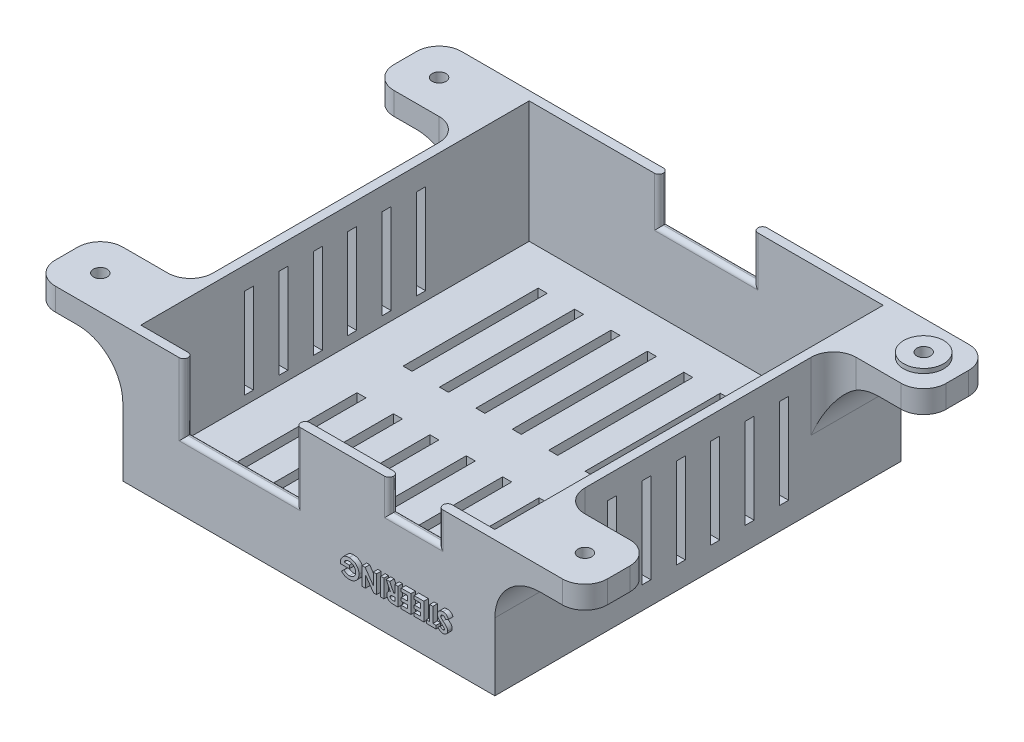
from build123d import *
from OCP.BRepFilletAPI import BRepFilletAPI_MakeFillet

# Parameters (mm, degrees)
SKETCH1_W               = 82.6
SKETCH1_H               = 90.22
BOSS_EXTRUDE1_DEPTH     = 30
SKETCH5_W               = 20
SKETCH5_H               = 15
BOSS_EXTRUDE3_DEPTH     = 5
SKETCH2_W               = 78.6
SKETCH2_H               = 86.22
CUT_EXTRUDE1_DEPTH      = 27
BOSS_EXTRUDE2_DEPTH     = 1
LEFTHOLESSKETCH_W       = 2
LEFTHOLESSKETCH_H       = 20
LEFTHOLES_DEPTH         = 126.035387059
BOTTOMHOLESSKETCH_W     = 11
BOTTOMHOLESSKETCH_H     = 7
BOTTOMHOLESSKETCH_W_2   = 25
BOTTOMHOLESSKETCH_H_2   = 15
BOTTOMHOLES_DEPTH       = 10
TOPHOLESSKETCH_W        = 21
TOPHOLESSKETCH_H        = 10
TOPHOLES_DEPTH          = 10
FILLET1_R1              = 10
FILLET1_R2              = 5
SKETCH6_6_R             = 4.45
BOSS_EXTRUDE4_DEPTH     = 1
CUT_EXTRUDE9_DEPTH      = 114.130807564
CUT_EXTRUDE9_DEPTH_BACK = 5
SKETCH6_R               = 1.525
FILLET2_R               = 1
SKETCH7_R               = 3.5
CUT_EXTRUDE10_DEPTH     = 10
SKETCH8_W               = 2
SKETCH8_H               = 30
CUT_EXTRUDE12_DEPTH     = 10
SKETCH9_W               = 0.717948718
SKETCH9_H               = 4
BOSS_EXTRUDE5_DEPTH     = 1


with BuildPart() as part:
    # Sketch1 → Boss-Extrude1 (new body)
    with BuildSketch(Plane(origin=(0, 0, 0), x_dir=(1, 0, 0), z_dir=(0, 1, 0))):
        with Locations((-26.401149425, -19.752068966)):
            Rectangle(SKETCH1_W, SKETCH1_H)
    extrude(amount=BOSS_EXTRUDE1_DEPTH)

    # Sketch5 → Boss-Extrude3 (add)
    with BuildSketch(Plane.XZ.offset(-30)):
        with Locations((24.898850575, -17.857931034)):
            Rectangle(SKETCH5_W, SKETCH5_H)
        with Locations((24.898850575, 57.362068966)):
            Rectangle(SKETCH5_W, SKETCH5_H)
        with Locations((-77.701149425, 57.362068966)):
            Rectangle(SKETCH5_W, SKETCH5_H)
        with Locations((-77.701149425, -17.857931034)):
            Rectangle(SKETCH5_W, SKETCH5_H)
    extrude(amount=BOSS_EXTRUDE3_DEPTH)

    # Sketch2 → Cut-Extrude1 (cut)
    with BuildSketch(Plane(origin=(0, 30, 0), x_dir=(1, 0, 0), z_dir=(0, 1, 0))):
        with Locations((-26.401149425, -19.752068966)):
            Rectangle(SKETCH2_W, SKETCH2_H)
    extrude(amount=-CUT_EXTRUDE1_DEPTH, mode=Mode.SUBTRACT)

    # Sketch4 → Boss-Extrude2 (add)
    # profile 1 of 6: a face of its own
    with BuildSketch(Plane(origin=(-31.128581926, 28.357931034, -25.357931034), x_dir=(-1, 0, 0), z_dir=(0, 0, 1))):
        with BuildLine():
            Line((-6.66624498, 19.200827591), (-8.765713729, 18.098011185))
            Line((-8.765713729, 18.098011185), (-6.66624498, 16.996683061))
            add(Edge.make_bspline(
                [(-6.66624498, 16.996683061), (-3.948147324, 18.053858842), (-3.718703965, 18.053858842), (-0.999614122, 16.996683061)],
                knots=[1, 1, 1, 1, 2, 2, 2, 2], degree=3))
            Line((-0.999614122, 16.996683061), (1.099358534, 18.098011185))
            Line((1.099358534, 18.098011185), (-0.999614122, 19.200827591))
            add(Edge.make_bspline(
                [(-0.999614122, 19.200827591), (-3.718703965, 18.143155717), (-3.948147324, 18.143155717), (-6.66624498, 19.200827591)],
                knots=[4, 4, 4, 4, 5, 5, 5, 5], degree=3))
        make_face()
    # profile 2 of 6: a face of its own
    with BuildSketch(Plane(origin=(-31.128581926, 28.357931034, -25.357931034), x_dir=(-1, 0, 0), z_dir=(0, 0, 1))):
        with BuildLine():
            Line((-6.66624498, 16.476280717), (-8.765713729, 15.374456499))
            Line((-8.765713729, 15.374456499), (-6.66624498, 14.272136186))
            add(Edge.make_bspline(
                [(-6.66624498, 14.272136186), (-3.948147324, 15.329808061), (-3.718703965, 15.329808061), (-0.999614122, 14.272136186)],
                knots=[1, 1, 1, 1, 2, 2, 2, 2], degree=3))
            Line((-0.999614122, 14.272136186), (1.099358534, 15.374456499))
            Line((1.099358534, 15.374456499), (-0.999614122, 16.476280717))
            add(Edge.make_bspline(
                [(-0.999614122, 16.476280717), (-3.718703965, 15.419104936), (-3.948147324, 15.419104936), (-6.66624498, 16.476280717)],
                knots=[4, 4, 4, 4, 5, 5, 5, 5], degree=3))
        make_face()
    # profile 3 of 6: a face of its own
    with BuildSketch(Plane(origin=(-31.128581926, 28.357931034, -25.357931034), x_dir=(-1, 0, 0), z_dir=(0, 0, 1))):
        with BuildLine():
            Line((-6.66624498, 13.752229936), (-8.765713729, 12.650405718))
            Line((-8.765713729, 12.650405718), (-6.66624498, 11.548581499))
            add(Edge.make_bspline(
                [(-6.66624498, 11.548581499), (-3.948147324, 12.60575728), (-3.718703965, 12.60575728), (-0.999614122, 11.548581499)],
                knots=[1, 1, 1, 1, 2, 2, 2, 2], degree=3))
            Line((-0.999614122, 11.548581499), (1.099358534, 12.650405718))
            Line((1.099358534, 12.650405718), (-0.999614122, 13.752229936))
            add(Edge.make_bspline(
                [(-0.999614122, 13.752229936), (-3.718703965, 12.694558062), (-3.948147324, 12.694558062), (-6.66624498, 13.752229936)],
                knots=[4, 4, 4, 4, 5, 5, 5, 5], degree=3))
        make_face()
    # profile 4 of 6: a face of its own
    with BuildSketch(Plane(origin=(-31.128581926, 28.357931034, -25.357931034), x_dir=(-1, 0, 0), z_dir=(0, 0, 1))):
        with BuildLine():
            Line((-0.845328966, 25.939268996), (0.464358534, 25.939268996))
            add(Edge.make_bspline(
                [(0.464358534, 25.939268996), (0.50354994, 25.939268996), (0.527610487, 25.927362746), (0.545221815, 25.910495558)],
                knots=[0, 0, 0, 0, 1, 1, 1, 1], degree=3))
            add(Edge.make_bspline(
                [(0.545221815, 25.910495558), (0.562585097, 25.892636183), (0.573995253, 25.869319777), (0.573995253, 25.829632277)],
                knots=[1, 1, 1, 1, 2, 2, 2, 2], degree=3))
            Line((0.573995253, 25.829632277), (0.573995253, 20.823054153))
            add(Edge.make_bspline(
                [(0.573995253, 20.823054153), (0.573995253, 20.783862747), (0.562585097, 20.760050247), (0.545221815, 20.742686966)],
                knots=[3, 3, 3, 3, 4, 4, 4, 4], degree=3))
            add(Edge.make_bspline(
                [(0.545221815, 20.742686966), (0.527610487, 20.725323685), (0.50354994, 20.713417435), (0.464358534, 20.713417435)],
                knots=[4, 4, 4, 4, 5, 5, 5, 5], degree=3))
            Line((0.464358534, 20.713417435), (-0.845328966, 20.713417435))
            add(Edge.make_bspline(
                [(-0.845328966, 20.713417435), (-1.354073106, 20.713417435), (-1.664379747, 20.829007278), (-1.852399278, 21.07258931)],
                knots=[6, 6, 6, 6, 7, 7, 7, 7], degree=3))
            add(Edge.make_bspline(
                [(-1.852399278, 21.07258931), (-2.129963731, 21.404972122), (-2.138893418, 21.941745559), (-2.138893418, 22.76476509)],
                knots=[7, 7, 7, 7, 8, 8, 8, 8], degree=3))
            Line((-2.138893418, 22.76476509), (-2.138893418, 23.88792134))
            add(Edge.make_bspline(
                [(-2.138893418, 23.88792134), (-2.138893418, 24.710940871), (-2.129963731, 25.247714309), (-1.852399278, 25.580097121)],
                knots=[9, 9, 9, 9, 10, 10, 10, 10], degree=3))
            add(Edge.make_bspline(
                [(-1.852399278, 25.580097121), (-1.664379747, 25.823679152), (-1.354073106, 25.939268996), (-0.845328966, 25.939268996)],
                knots=[10, 10, 10, 10, 11, 11, 11, 11], degree=3))
        make_face()
        with BuildLine():
            Line((-0.256961778, 21.324604935), (-0.256961778, 25.32857759))
            Line((-0.256961778, 25.32857759), (-0.718825059, 25.32857759))
            add(Edge.make_bspline(
                [(-0.718825059, 25.32857759), (-0.922719591, 25.32857759), (-1.044510606, 25.295339309), (-1.138768419, 25.182229934)],
                knots=[1, 1, 1, 1, 2, 2, 2, 2], degree=3))
            add(Edge.make_bspline(
                [(-1.138768419, 25.182229934), (-1.284123887, 25.007604934), (-1.296526231, 24.655378371), (-1.296526231, 23.945468215)],
                knots=[2, 2, 2, 2, 3, 3, 3, 3], degree=3))
            Line((-1.296526231, 23.945468215), (-1.296526231, 22.707218215))
            add(Edge.make_bspline(
                [(-1.296526231, 22.707218215), (-1.296526231, 21.997308059), (-1.284123887, 21.645081497), (-1.138768419, 21.470456497)],
                knots=[4, 4, 4, 4, 5, 5, 5, 5], degree=3))
            add(Edge.make_bspline(
                [(-1.138768419, 21.470456497), (-1.044510606, 21.357347122), (-0.922719591, 21.324604935), (-0.718825059, 21.324604935)],
                knots=[5, 5, 5, 5, 6, 6, 6, 6], degree=3))
            Line((-0.718825059, 21.324604935), (-0.256961778, 21.324604935))
        make_face(mode=Mode.SUBTRACT)
    # profile 5 of 6: a face of its own
    with BuildSketch(Plane(origin=(-31.128581926, 28.357931034, -25.357931034), x_dir=(-1, 0, 0), z_dir=(0, 0, 1))):
        with BuildLine():
            Line((-8.211577011, 22.132245559), (-8.211577011, 25.829632277))
            add(Edge.make_bspline(
                [(-8.211577011, 25.829632277), (-8.211577011, 25.869319777), (-8.199670761, 25.892636183), (-8.182307479, 25.910495558)],
                knots=[0, 0, 0, 0, 1, 1, 1, 1], degree=3))
            add(Edge.make_bspline(
                [(-8.182307479, 25.910495558), (-8.165192245, 25.927362746), (-8.140883651, 25.939268996), (-8.101940292, 25.939268996)],
                knots=[1, 1, 1, 1, 2, 2, 2, 2], degree=3))
            Line((-8.101940292, 25.939268996), (-7.489760605, 25.939268996))
            add(Edge.make_bspline(
                [(-7.489760605, 25.939268996), (-7.450569198, 25.939268996), (-7.426756698, 25.927362746), (-7.409393417, 25.910495558)],
                knots=[3, 3, 3, 3, 4, 4, 4, 4], degree=3))
            add(Edge.make_bspline(
                [(-7.409393417, 25.910495558), (-7.391782089, 25.892636183), (-7.380123886, 25.869319777), (-7.380123886, 25.829632277)],
                knots=[4, 4, 4, 4, 5, 5, 5, 5], degree=3))
            Line((-7.380123886, 25.829632277), (-7.380123886, 22.133237747))
            add(Edge.make_bspline(
                [(-7.380123886, 22.133237747), (-7.380123886, 21.747772903), (-7.350854355, 21.518577591), (-7.22583873, 21.380663528)],
                knots=[6, 6, 6, 6, 7, 7, 7, 7], degree=3))
            add(Edge.make_bspline(
                [(-7.22583873, 21.380663528), (-7.140758652, 21.287397903), (-7.02020787, 21.241757278), (-6.852032089, 21.241757278)],
                knots=[7, 7, 7, 7, 8, 8, 8, 8], degree=3))
            add(Edge.make_bspline(
                [(-6.852032089, 21.241757278), (-6.69873912, 21.241757278), (-6.583149277, 21.284421341), (-6.494844589, 21.381655716)],
                knots=[8, 8, 8, 8, 9, 9, 9, 9], degree=3))
            add(Edge.make_bspline(
                [(-6.494844589, 21.381655716), (-6.376278183, 21.512128372), (-6.340311386, 21.733882278), (-6.340311386, 22.133237747)],
                knots=[9, 9, 9, 9, 10, 10, 10, 10], degree=3))
            Line((-6.340311386, 22.133237747), (-6.340311386, 25.829632277))
            add(Edge.make_bspline(
                [(-6.340311386, 25.829632277), (-6.340311386, 25.869319777), (-6.328157089, 25.892636183), (-6.310545761, 25.910495558)],
                knots=[11, 11, 11, 11, 12, 12, 12, 12], degree=3))
            add(Edge.make_bspline(
                [(-6.310545761, 25.910495558), (-6.293678574, 25.927362746), (-6.269618027, 25.939268996), (-6.230178574, 25.939268996)],
                knots=[12, 12, 12, 12, 13, 13, 13, 13], degree=3))
            Line((-6.230178574, 25.939268996), (-5.61849498, 25.939268996))
            add(Edge.make_bspline(
                [(-5.61849498, 25.939268996), (-5.579055527, 25.939268996), (-5.55499498, 25.927362746), (-5.538127793, 25.910495558)],
                knots=[14, 14, 14, 14, 15, 15, 15, 15], degree=3))
            add(Edge.make_bspline(
                [(-5.538127793, 25.910495558), (-5.520268418, 25.892636183), (-5.508858261, 25.869319777), (-5.508858261, 25.829632277)],
                knots=[15, 15, 15, 15, 16, 16, 16, 16], degree=3))
            Line((-5.508858261, 25.829632277), (-5.508858261, 22.132245559))
            add(Edge.make_bspline(
                [(-5.508858261, 22.132245559), (-5.508858261, 21.593983841), (-5.582032089, 21.256640091), (-5.795848496, 21.021491653)],
                knots=[17, 17, 17, 17, 18, 18, 18, 18], degree=3))
            add(Edge.make_bspline(
                [(-5.795848496, 21.021491653), (-6.017850449, 20.776917435), (-6.353953964, 20.647436966), (-6.862698105, 20.647436966)],
                knots=[18, 18, 18, 18, 19, 19, 19, 19], degree=3))
            add(Edge.make_bspline(
                [(-6.862698105, 20.647436966), (-7.37739537, 20.647436966), (-7.708785995, 20.785351028), (-7.912680526, 21.021987747)],
                knots=[19, 19, 19, 19, 20, 20, 20, 20], degree=3))
            add(Edge.make_bspline(
                [(-7.912680526, 21.021987747), (-8.152293808, 21.300296341), (-8.211577011, 21.632679153), (-8.211577011, 22.132245559)],
                knots=[20, 20, 20, 20, 21, 21, 21, 21], degree=3))
        make_face()
    # profile 6 of 6: a face of its own
    with BuildSketch(Plane(origin=(-31.128581926, 28.357931034, -25.357931034), x_dir=(-1, 0, 0), z_dir=(0, 0, 1))):
        with BuildLine():
            Line((-4.259694199, 25.278968215), (-4.259694199, 20.823054153))
            add(Edge.make_bspline(
                [(-4.259694199, 20.823054153), (-4.259694199, 20.783862747), (-4.248284043, 20.760050247), (-4.230920762, 20.742686966)],
                knots=[0, 0, 0, 0, 1, 1, 1, 1], degree=3))
            add(Edge.make_bspline(
                [(-4.230920762, 20.742686966), (-4.213309434, 20.725323685), (-4.189496934, 20.713417435), (-4.150553574, 20.713417435)],
                knots=[1, 1, 1, 1, 2, 2, 2, 2], degree=3))
            Line((-4.150553574, 20.713417435), (-3.480578965, 20.713417435))
            add(Edge.make_bspline(
                [(-3.480578965, 20.713417435), (-3.441635606, 20.713417435), (-3.417327012, 20.725323685), (-3.400211777, 20.742686966)],
                knots=[3, 3, 3, 3, 4, 4, 4, 4], degree=3))
            add(Edge.make_bspline(
                [(-3.400211777, 20.742686966), (-3.382352402, 20.760050247), (-3.370942246, 20.783862747), (-3.370942246, 20.823054153)],
                knots=[4, 4, 4, 4, 5, 5, 5, 5], degree=3))
            Line((-3.370942246, 20.823054153), (-3.370942246, 25.278968215))
            Line((-3.370942246, 25.278968215), (-2.5848817, 25.278968215))
            add(Edge.make_bspline(
                [(-2.5848817, 25.278968215), (-2.545442246, 25.278968215), (-2.521877793, 25.290378371), (-2.504018418, 25.307741652)],
                knots=[7, 7, 7, 7, 8, 8, 8, 8], degree=3))
            add(Edge.make_bspline(
                [(-2.504018418, 25.307741652), (-2.486655137, 25.325104934), (-2.474748887, 25.349413527), (-2.474748887, 25.388604934)],
                knots=[8, 8, 8, 8, 9, 9, 9, 9], degree=3))
            Line((-2.474748887, 25.388604934), (-2.474748887, 25.829632277))
            add(Edge.make_bspline(
                [(-2.474748887, 25.829632277), (-2.474748887, 25.869319777), (-2.486655137, 25.892636183), (-2.504018418, 25.910495558)],
                knots=[10, 10, 10, 10, 11, 11, 11, 11], degree=3))
            add(Edge.make_bspline(
                [(-2.504018418, 25.910495558), (-2.521877793, 25.927362746), (-2.545442246, 25.939268996), (-2.5848817, 25.939268996)],
                knots=[11, 11, 11, 11, 12, 12, 12, 12], degree=3))
            Line((-2.5848817, 25.939268996), (-5.046002793, 25.939268996))
            add(Edge.make_bspline(
                [(-5.046002793, 25.939268996), (-5.085442246, 25.939268996), (-5.109502793, 25.927362746), (-5.127114121, 25.910495558)],
                knots=[13, 13, 13, 13, 14, 14, 14, 14], degree=3))
            add(Edge.make_bspline(
                [(-5.127114121, 25.910495558), (-5.143733261, 25.892636183), (-5.155887558, 25.869319777), (-5.155887558, 25.829632277)],
                knots=[14, 14, 14, 14, 15, 15, 15, 15], degree=3))
            Line((-5.155887558, 25.829632277), (-5.155887558, 25.388604934))
            add(Edge.make_bspline(
                [(-5.155887558, 25.388604934), (-5.155887558, 25.349413527), (-5.143733261, 25.325104934), (-5.127114121, 25.307741652)],
                knots=[16, 16, 16, 16, 17, 17, 17, 17], degree=3))
            add(Edge.make_bspline(
                [(-5.127114121, 25.307741652), (-5.109502793, 25.290378371), (-5.085442246, 25.278968215), (-5.046002793, 25.278968215)],
                knots=[17, 17, 17, 17, 18, 18, 18, 18], degree=3))
            Line((-5.046002793, 25.278968215), (-4.259694199, 25.278968215))
        make_face()
    extrude(amount=-BOSS_EXTRUDE2_DEPTH)

    # LeftHolesSketch → LeftHoles (cut, through all)
    with BuildSketch(Plane(origin=(14.898850575, 0, 0), x_dir=(0, 0, -1), z_dir=(1, 0, 0))):
        with Locations((-38.862068966, 15)):
            Rectangle(LEFTHOLESSKETCH_W, LEFTHOLESSKETCH_H)
        with Locations((-31.218068966, 15)):
            Rectangle(LEFTHOLESSKETCH_W, LEFTHOLESSKETCH_H)
        with Locations((-23.574068966, 15)):
            Rectangle(LEFTHOLESSKETCH_W, LEFTHOLESSKETCH_H)
        with Locations((-15.930068966, 15)):
            Rectangle(LEFTHOLESSKETCH_W, LEFTHOLESSKETCH_H)
        with Locations((-8.286068966, 15)):
            Rectangle(LEFTHOLESSKETCH_W, LEFTHOLESSKETCH_H)
        with Locations((-0.642068966, 15)):
            Rectangle(LEFTHOLESSKETCH_W, LEFTHOLESSKETCH_H)
    extrude(amount=-LEFTHOLES_DEPTH, mode=Mode.SUBTRACT)

    # BottomHolesSketch → BottomHoles (cut)
    with BuildSketch(Plane.XY.offset(64.862068966)):
        with Locations((-3.101149425, 26.5)):
            Rectangle(BOTTOMHOLESSKETCH_W, BOTTOMHOLESSKETCH_H)
        with Locations((-41.701149425, 22.5)):
            Rectangle(BOTTOMHOLESSKETCH_W_2, BOTTOMHOLESSKETCH_H_2)
    extrude(amount=-BOTTOMHOLES_DEPTH, mode=Mode.SUBTRACT)

    # TopHolesSketch → TopHoles (cut)
    with BuildSketch(Plane(origin=(0, 0, -25.357931034), x_dir=(-1, 0, 0), z_dir=(0, 0, -1))):
        with Locations((26.401149425, 25)):
            Rectangle(TOPHOLESSKETCH_W, TOPHOLESSKETCH_H)
    extrude(amount=-TOPHOLES_DEPTH, mode=Mode.SUBTRACT)

    # Fillet1: one fillet with a radius per group of edges: ONE call of the kernel's fillet builder (fillet() takes one radius for all edges)
    fillet1_edges_1 = [part.edges().sort_by_distance(p)[0] for p in [
        (-67.701149425, 25, -17.857931034),
        (-67.701149425, 25, 57.362068966),
        (14.898850575, 25, -17.857931034),
        (14.898850575, 25, 57.362068966),
    ]]
    fillet1_edges_2 = [part.edges().sort_by_distance(p)[0] for p in [
        (-87.701149425, 27.5, -25.357931034),
        (-87.701149425, 27.5, -10.357931034),
        (-67.701149425, 27.5, -10.357931034),
        (-67.701149425, 27.5, 49.862068966),
        (-87.701149425, 27.5, 49.862068966),
        (-87.701149425, 27.5, 64.862068966),
        (14.898850575, 27.5, 49.862068966),
        (34.898850575, 27.5, 49.862068966),
        (34.898850575, 27.5, 64.862068966),
        (34.898850575, 27.5, -25.357931034),
        (34.898850575, 27.5, -10.357931034),
        (14.898850575, 27.5, -10.357931034),
    ]]
    fillet1 = BRepFilletAPI_MakeFillet(part.part.solid().wrapped)
    for e in fillet1_edges_1:
        fillet1.Add(FILLET1_R1, e.wrapped)
    for e in fillet1_edges_2:
        fillet1.Add(FILLET1_R2, e.wrapped)
    add(Compound.cast(fillet1.Shape()), mode=Mode.REPLACE)

    # Sketch6<6> → Boss-Extrude4 (add)
    with BuildSketch(Plane(origin=(0, 30, 0), x_dir=(-1, 0, 0), z_dir=(0, -1, 0))):
        with Locations(Location((-27.398850575, 17.857931034, 0), (0, 0, 90))):
            Circle(SKETCH6_6_R)
    extrude(amount=-BOSS_EXTRUDE4_DEPTH)

    # Sketch6 → Cut-Extrude9 (cut, two sides: drawn at the far end of the back side and taken through both)
    with BuildSketch(Plane(origin=(0, 30, 0), x_dir=(-1, 0, 0), z_dir=(0, -1, 0)).offset(-CUT_EXTRUDE9_DEPTH_BACK)):
        with Locations(Location((-27.398850575, 17.857931034, 0), (0, 0, 90))):
            Circle(SKETCH6_R)
        with Locations(Location((-27.398850575, -57.362068966, 0), (0, 0, 270))):
            Circle(SKETCH6_R)
        with Locations(Location((80.201149425, -57.362068966, 0), (0, 0, 90))):
            Circle(SKETCH6_R)
        with Locations(Location((80.201149425, 17.857931034, 0), (0, 0, 270))):
            Circle(SKETCH6_R)
    extrude(amount=CUT_EXTRUDE9_DEPTH + CUT_EXTRUDE9_DEPTH_BACK, mode=Mode.SUBTRACT)

    # Fillet2
    fillet2_edges = [part.edges().sort_by_distance(p)[0] for p in [
        (-3.101149425, 23, 62.862068966),
        (-3.101149425, 23, 64.862068966),
        (-8.601149425, 26.5, 62.862068966),
        (-8.601149425, 26.5, 64.862068966),
        (2.398850575, 26.5, 62.862068966),
        (2.398850575, 26.5, 64.862068966),
        (-41.701149425, 15, 62.862068966),
        (-41.701149425, 15, 64.862068966),
        (-54.201149425, 22.5, 64.862068966),
        (-54.201149425, 22.5, 62.862068966),
        (-29.201149425, 22.5, 62.862068966),
        (-29.201149425, 22.5, 64.862068966),
        (-36.901149425, 25, -23.357931034),
        (-36.901149425, 25, -25.357931034),
        (-15.901149425, 25, -25.357931034),
        (-15.901149425, 25, -23.357931034),
        (-26.401149425, 20, -23.357931034),
        (-26.401149425, 20, -25.357931034),
    ]]
    fillet(fillet2_edges, radius=FILLET2_R - 0.0001)  # a hair under: the kernel refuses the full size

    # Sketch7 → Cut-Extrude10 (cut)
    with BuildSketch(Plane.XZ.offset(-25)):
        with Locations((-80.201149425, 57.362068966)):
            Circle(SKETCH7_R)
        with Locations((27.398850575, 57.362068966)):
            Circle(SKETCH7_R)
        with Locations((27.398850575, -17.857931034)):
            Circle(SKETCH7_R)
        with Locations((-80.201149425, -17.857931034)):
            Circle(SKETCH7_R)
    extrude(amount=CUT_EXTRUDE10_DEPTH, mode=Mode.SUBTRACT)

    # Sketch8 → Cut-Extrude12 (cut)
    with BuildSketch(Plane.XZ):
        with Locations((-6.186863711, -0.357931034)):
            Rectangle(SKETCH8_W, SKETCH8_H)
        with Locations((1.898850575, -0.357931034)):
            Rectangle(SKETCH8_W, SKETCH8_H)
        with Locations((-14.272577997, -0.357931034)):
            Rectangle(SKETCH8_W, SKETCH8_H)
        with Locations((-22.358292282, -0.357931034)):
            Rectangle(SKETCH8_W, SKETCH8_H)
        with Locations((-30.444006568, -0.357931034)):
            Rectangle(SKETCH8_W, SKETCH8_H)
        with Locations((-38.529720854, -0.357931034)):
            Rectangle(SKETCH8_W, SKETCH8_H)
        with Locations((-46.61543514, -0.357931034)):
            Rectangle(SKETCH8_W, SKETCH8_H)
        with Locations((-54.701149425, -0.357931034)):
            Rectangle(SKETCH8_W, SKETCH8_H)
        with Locations((-6.186863711, 39.862068966)):
            Rectangle(SKETCH8_W, SKETCH8_H)
        with Locations((-14.272577997, 39.862068966)):
            Rectangle(SKETCH8_W, SKETCH8_H)
        with Locations((-22.358292282, 39.862068966)):
            Rectangle(SKETCH8_W, SKETCH8_H)
        with Locations((-30.444006568, 39.862068966)):
            Rectangle(SKETCH8_W, SKETCH8_H)
        with Locations((-38.529720854, 39.862068966)):
            Rectangle(SKETCH8_W, SKETCH8_H)
        with Locations((-46.61543514, 39.862068966)):
            Rectangle(SKETCH8_W, SKETCH8_H)
        with Locations((-54.701149425, 39.862068966)):
            Rectangle(SKETCH8_W, SKETCH8_H)
        with Locations((1.898850575, 39.862068966)):
            Rectangle(SKETCH8_W, SKETCH8_H)
    extrude(amount=-CUT_EXTRUDE12_DEPTH, mode=Mode.SUBTRACT)

    # Sketch9 → Boss-Extrude5 (add)
    # profile 1 of 8: a face of its own
    with BuildSketch(Plane.XY.offset(64.862068966)):
        with BuildLine():
            Line((3.268192278, 7.862766785), (3.805051252, 8.353952683))
            add(Edge.make_bspline(
                [(3.805051252, 8.353952683), (3.828043563, 8.3215076), (3.872185595, 8.259217566), (3.943807144, 8.175900794), (4.015000806, 8.104359121), (4.087222207, 8.046638006), (4.159227921, 8.000170689), (4.232547748, 7.968120307), (4.306338195, 7.947508515), (4.35594002, 7.944954347), (4.380371765, 7.943696272)],
                knots=[0, 0, 0, 0, 1.299459705, 2.494781419, 3.587730629, 4.594196874, 5.512431013, 6.380462003, 7.202284646, 8, 8, 8, 8], degree=3))
            add(Edge.make_bspline(
                [(4.380371765, 7.943696272), (4.403170329, 7.944471661), (4.447188368, 7.945968733), (4.509647058, 7.961598337), (4.565776743, 7.986854935), (4.61408228, 8.021742897), (4.652943033, 8.063409247), (4.68315959, 8.10776511), (4.70071849, 8.156127606), (4.702973399, 8.189295452), (4.704089713, 8.205715503)],
                knots=[0, 0, 0, 0, 1.184157716, 2.286297433, 3.324836695, 4.370048774, 5.362957217, 6.276446515, 7.146738784, 8, 8, 8, 8], degree=3))
            add(Edge.make_bspline(
                [(4.704089713, 8.205715503), (4.703383088, 8.222364632), (4.701960043, 8.255893663), (4.688215364, 8.305034634), (4.667498209, 8.353051084), (4.647702121, 8.382280981), (4.637583303, 8.397221913)],
                knots=[0, 0, 0, 0, 0.967525499, 1.948461899, 2.951351359, 4, 4, 4, 4], degree=3))
            add(Edge.make_bspline(
                [(4.637583303, 8.397221913), (4.628347107, 8.408800794), (4.606963756, 8.435607853), (4.567429234, 8.478744125), (4.515735467, 8.529383708), (4.454067342, 8.590078189), (4.380110571, 8.658469978), (4.295453038, 8.736539281), (4.198211212, 8.821634142), (4.130083388, 8.881707235), (4.094314072, 8.913247555)],
                knots=[0, 0, 0, 0, 0.473849886, 1.097042329, 1.870584189, 2.789244661, 3.865562256, 5.093556389, 6.47402294, 8, 8, 8, 8], degree=3))
            add(Edge.make_bspline(
                [(4.094314072, 8.913247555), (4.060658973, 8.942359456), (3.996788588, 8.997607798), (3.906028886, 9.076152902), (3.825746899, 9.14650086), (3.756672758, 9.20917846), (3.696742364, 9.261604558), (3.648606302, 9.307004479), (3.610204447, 9.343392175), (3.588396694, 9.36539555), (3.579089713, 9.374786016)],
                knots=[0, 0, 0, 0, 1.543627419, 2.929484142, 4.163674036, 5.24627963, 6.164986907, 6.925413438, 7.541394495, 8, 8, 8, 8], degree=3))
            add(Edge.make_bspline(
                [(3.579089713, 9.374786016), (3.543759199, 9.412991186), (3.475841543, 9.48643494), (3.387745561, 9.600557768), (3.314458221, 9.711103653), (3.25770468, 9.821194227), (3.216544501, 9.933104619), (3.18658135, 10.048431511), (3.168621334, 10.168823849), (3.166633569, 10.250794106), (3.165628175, 10.292253965)],
                knots=[0, 0, 0, 0, 1.206413378, 2.319150186, 3.339784753, 4.27899982, 5.184598145, 6.099639703, 7.038813909, 8, 8, 8, 8], degree=3))
            add(Edge.make_bspline(
                [(3.165628175, 10.292253965), (3.166344669, 10.332651845), (3.167750457, 10.411913989), (3.184950019, 10.527907713), (3.209510643, 10.638898151), (3.247355668, 10.743773404), (3.293870185, 10.843776329), (3.350560163, 10.938940555), (3.419869327, 11.027044377), (3.496851607, 11.110465079), (3.583333077, 11.185343855), (3.676328505, 11.251359157), (3.776014989, 11.30709753), (3.881632847, 11.353031695), (3.994506696, 11.387119915), (4.112853402, 11.412892596), (4.237865354, 11.428432304), (4.323169435, 11.430049539), (4.36674997, 11.43087576)],
                knots=[0, 0, 0, 0, 1.043039441, 2.046482205, 3.024244422, 3.976033659, 4.920890471, 5.871402525, 6.830893638, 7.812473116, 8.800703348, 9.781190227, 10.754606487, 11.746997808, 12.751247331, 13.796362838, 14.874195872, 16, 16, 16, 16], degree=3))
            add(Edge.make_bspline(
                [(4.36674997, 11.43087576), (4.400960821, 11.430269498), (4.468717927, 11.429068753), (4.56857694, 11.419245528), (4.665020177, 11.403441856), (4.75785501, 11.380615982), (4.847668676, 11.352353694), (4.933486499, 11.315602622), (5.016449479, 11.274042017), (5.096281717, 11.225880007), (5.172321684, 11.169944506), (5.246760233, 11.108443256), (5.316958443, 11.038003174), (5.385598396, 10.96119218), (5.44981335, 10.875784107), (5.512987085, 10.784348964), (5.572036275, 10.684700936), (5.608527651, 10.61481111), (5.627166637, 10.579112939)],
                knots=[0, 0, 0, 0, 1.017088714, 2.014418954, 2.980620591, 3.920647918, 4.854987948, 5.776890852, 6.693269322, 7.612671471, 8.545186947, 9.498010697, 10.480815007, 11.499174288, 12.558697099, 13.655746277, 14.802607237, 16, 16, 16, 16], degree=3))
            Line((5.627166637, 10.579112939), (4.99575638, 10.200106529))
            add(Edge.make_bspline(
                [(4.99575638, 10.200106529), (4.972443454, 10.240629973), (4.927750581, 10.318316879), (4.852014331, 10.422699084), (4.774426408, 10.512085164), (4.693193051, 10.584895214), (4.609302026, 10.642102799), (4.522348121, 10.682987308), (4.432270242, 10.708294773), (4.370913283, 10.711385399), (4.340307662, 10.712927042)],
                knots=[0, 0, 0, 0, 1.283663364, 2.460892379, 3.537111102, 4.529833553, 5.449777664, 6.316464042, 7.160231139, 8, 8, 8, 8], degree=3))
            add(Edge.make_bspline(
                [(4.340307662, 10.712927042), (4.309171631, 10.711680016), (4.248763196, 10.709260604), (4.162395937, 10.686472199), (4.082864127, 10.651495002), (4.014486967, 10.600626048), (3.956421614, 10.542620644), (3.914794723, 10.477199682), (3.887792814, 10.407265484), (3.884987703, 10.358464653), (3.883576893, 10.333920631)],
                knots=[0, 0, 0, 0, 1.13537643, 2.202795631, 3.242191317, 4.290390765, 5.297919085, 6.223733717, 7.106639842, 8, 8, 8, 8], degree=3))
            add(Edge.make_bspline(
                [(3.883576893, 10.333920631), (3.884897451, 10.311097874), (3.88758004, 10.264735626), (3.907231621, 10.195762401), (3.938210833, 10.127123624), (3.973763117, 10.070228389), (4.010828288, 10.022803844), (4.047159257, 9.982330486), (4.090217738, 9.93667894), (4.141100886, 9.887094073), (4.198819031, 9.832622526), (4.263561132, 9.773393809), (4.3360244, 9.709890725), (4.387243639, 9.666634819), (4.414025611, 9.644016785)],
                knots=[0, 0, 0, 0, 0.916057066, 1.860882232, 2.859899639, 3.934694552, 4.546382938, 5.276161949, 6.118633209, 7.067046139, 8.129668089, 9.306861125, 10.591787583, 12, 12, 12, 12], degree=3))
            add(Edge.make_bspline(
                [(4.414025611, 9.644016785), (4.464937298, 9.600937788), (4.562652236, 9.518256154), (4.700760496, 9.396162161), (4.825121765, 9.28196916), (4.934906647, 9.174763595), (5.030441257, 9.075230442), (5.112777297, 8.984243507), (5.18058426, 8.900018549), (5.25089592, 8.799421808), (5.319592474, 8.678566724), (5.377974767, 8.532481017), (5.415706275, 8.386578218), (5.4199498, 8.28846248), (5.422038431, 8.240170631)],
                knots=[0, 0, 0, 0, 1.345685333, 2.582777463, 3.719355561, 4.752181389, 5.678433858, 6.502864483, 7.227563063, 7.858499643, 8.978226409, 10.023061349, 11.026965269, 12, 12, 12, 12], degree=3))
            add(Edge.make_bspline(
                [(5.422038431, 8.240170631), (5.421169365, 8.205925451), (5.41945721, 8.138458767), (5.404229748, 8.039247206), (5.381365887, 7.943561631), (5.348509105, 7.851426254), (5.304439162, 7.763879025), (5.252384485, 7.679502973), (5.190862836, 7.598555993), (5.120352491, 7.522833727), (5.04295154, 7.453225922), (4.960395899, 7.392156095), (4.873448313, 7.340515642), (4.781845114, 7.298446375), (4.685748395, 7.26561766), (4.585069397, 7.242417075), (4.480116652, 7.228581654), (4.408725685, 7.226704024), (4.372358944, 7.225747555)],
                knots=[0, 0, 0, 0, 1.010806554, 1.991397492, 2.957573065, 3.913225829, 4.872777376, 5.846906201, 6.837692339, 7.870332167, 8.898170327, 9.907899016, 10.8981826, 11.879407896, 12.8797257, 13.891947133, 14.926152479, 16, 16, 16, 16], degree=3))
            add(Edge.make_bspline(
                [(4.372358944, 7.225747555), (4.32523224, 7.227476245), (4.231350832, 7.230919979), (4.092503381, 7.257708409), (3.956816222, 7.30028049), (3.847138367, 7.350428487), (3.760620531, 7.400555586), (3.694151501, 7.44576993), (3.625988223, 7.497691511), (3.557382057, 7.557831285), (3.485731438, 7.622712798), (3.41465549, 7.696788632), (3.340673718, 7.776263353), (3.292776012, 7.833427173), (3.268192278, 7.862766785)],
                knots=[0, 0, 0, 0, 1.282890948, 2.555655204, 3.837225328, 5.149160694, 5.83044799, 6.558852598, 7.337307105, 8.162686284, 9.043076448, 9.969084596, 10.957622644, 12, 12, 12, 12], degree=3))
        make_face()
    # profile 2 of 8: a face of its own
    with BuildSketch(Plane.XY.offset(64.862068966)):
        Polygon((2.857935867, 7.328311657), (0.704089713, 7.328311657), (0.704089713, 8.046260375), (1.422038431, 8.046260375), (1.422038431, 11.328311657), (2.139987149, 11.328311657), (2.139987149, 8.046260375), (2.857935867, 8.046260375), align=None)
    # profile 3 of 8: a face of its own
    with BuildSketch(Plane.XY.offset(64.862068966)):
        Polygon((0.139987149, 7.328311657), (-2.013859004, 7.328311657), (-2.013859004, 8.046260375), (-0.577961569, 8.046260375), (-0.577961569, 8.815491144), (-2.013859004, 8.815491144), (-2.013859004, 9.533439862), (-0.577961569, 9.533439862), (-0.577961569, 10.610362939), (-2.013859004, 10.610362939), (-2.013859004, 11.328311657), (0.139987149, 11.328311657), align=None)
    # profile 4 of 8: a face of its own
    with BuildSketch(Plane.XY.offset(64.862068966)):
        Polygon((-2.731807722, 7.328311657), (-4.885653876, 7.328311657), (-4.885653876, 8.046260375), (-3.44975644, 8.046260375), (-3.44975644, 8.815491144), (-4.885653876, 8.815491144), (-4.885653876, 9.533439862), (-3.44975644, 9.533439862), (-3.44975644, 10.610362939), (-4.885653876, 10.610362939), (-4.885653876, 11.328311657), (-2.731807722, 11.328311657), align=None)
    # profile 5 of 8: a face of its own
    with BuildSketch(Plane.XY.offset(64.862068966)):
        with BuildLine():
            Line((-5.603602594, 7.328311657), (-6.440141056, 7.328311657))
            add(Edge.make_bspline(
                [(-6.440141056, 7.328311657), (-6.495436485, 7.328504449), (-6.601785172, 7.328875243), (-6.755126295, 7.334876748), (-6.896019047, 7.343009991), (-7.024776448, 7.356184334), (-7.141251755, 7.37132275), (-7.245207444, 7.391645058), (-7.337030142, 7.414189262), (-7.417849379, 7.44193108), (-7.490607332, 7.473827994), (-7.558161537, 7.50993712), (-7.622199843, 7.551241116), (-7.682255942, 7.597607377), (-7.740177939, 7.647275001), (-7.792864741, 7.703130648), (-7.842666733, 7.763346163), (-7.889060831, 7.827925442), (-7.930716089, 7.89671774), (-7.966635388, 7.968900658), (-7.997562985, 8.044036342), (-8.022039067, 8.122399329), (-8.041558885, 8.203766535), (-8.05461196, 8.28793608), (-8.064310363, 8.375096144), (-8.06486045, 8.434319257), (-8.065141056, 8.464529606)],
                knots=[0, 0, 0, 0, 1.748592178, 3.36303531, 4.852592433, 6.210838904, 7.455605234, 8.565530618, 9.559147328, 10.443333557, 11.264119507, 12.069061813, 12.863340979, 13.67089394, 14.467102114, 15.273638367, 16.095597024, 16.937114566, 17.786018611, 18.63597263, 19.484582448, 20.352808207, 21.22970172, 22.128176732, 23.04516274, 24, 24, 24, 24], degree=3))
            add(Edge.make_bspline(
                [(-8.065141056, 8.464529606), (-8.064402477, 8.496060627), (-8.062954258, 8.557887213), (-8.055218037, 8.64871736), (-8.040835492, 8.73582799), (-8.019760921, 8.818660077), (-7.994535899, 8.898061968), (-7.961867062, 8.9727944), (-7.924717567, 9.044179384), (-7.880646216, 9.11104056), (-7.832249602, 9.174814795), (-7.776042671, 9.233185834), (-7.715201338, 9.288920699), (-7.647874164, 9.340121422), (-7.574262719, 9.386469272), (-7.495751193, 9.429846829), (-7.411254557, 9.469483636), (-7.351902376, 9.49165389), (-7.321551312, 9.502991144)],
                knots=[0, 0, 0, 0, 1.099808295, 2.156523617, 3.176426857, 4.17500812, 5.135317955, 6.078349783, 7.015890908, 7.9382699, 8.868004242, 9.803692517, 10.759882289, 11.743580734, 12.748787378, 13.791075452, 14.870417076, 16, 16, 16, 16], degree=3))
            Line((-7.321551312, 9.502991144), (-8.244628235, 11.328311657))
            Line((-8.244628235, 11.328311657), (-7.446551312, 11.328311657))
            Line((-7.446551312, 11.328311657), (-6.565141056, 9.584721913))
            Line((-6.565141056, 9.584721913), (-6.321551312, 9.584721913))
            Line((-6.321551312, 9.584721913), (-6.321551312, 11.328311657))
            Line((-6.321551312, 11.328311657), (-5.603602594, 11.328311657))
            Line((-5.603602594, 11.328311657), (-5.603602594, 7.328311657))
        make_face()
        with BuildLine():
            Line((-6.321551312, 8.866773196), (-6.601198748, 8.866773196))
            add(Edge.make_bspline(
                [(-6.601198748, 8.866773196), (-6.635387977, 8.866388139), (-6.700853005, 8.865650839), (-6.795000225, 8.862230812), (-6.880508658, 8.853990655), (-6.957744189, 8.843578436), (-7.027099691, 8.831559434), (-7.087943055, 8.814323895), (-7.141254585, 8.795889222), (-7.186268832, 8.772869899), (-7.224884917, 8.747152274), (-7.257253084, 8.71664737), (-7.285768275, 8.683230866), (-7.308135837, 8.64479951), (-7.326207386, 8.602927828), (-7.337414777, 8.556828043), (-7.34630678, 8.507334848), (-7.346889239, 8.472856186), (-7.347192338, 8.454914221)],
                knots=[0, 0, 0, 0, 1.688935225, 3.233948049, 4.651771667, 5.929878493, 7.083962697, 8.124219224, 9.050753627, 9.864999381, 10.615157594, 11.334035464, 12.05533055, 12.777108108, 13.522027315, 14.29964284, 15.115170198, 16, 16, 16, 16], degree=3))
            add(Edge.make_bspline(
                [(-7.347192338, 8.454914221), (-7.346417839, 8.433703339), (-7.344905943, 8.392297693), (-7.32855809, 8.332520888), (-7.303891229, 8.276790931), (-7.268970377, 8.225879776), (-7.22540508, 8.181335551), (-7.175480642, 8.142305089), (-7.118239762, 8.111065942), (-7.065385958, 8.089759817), (-7.016507402, 8.077479063), (-6.972689736, 8.068694648), (-6.921853123, 8.061578322), (-6.86406986, 8.05634102), (-6.799446134, 8.051357625), (-6.727828587, 8.048272367), (-6.649281214, 8.046895656), (-6.594521822, 8.046478233), (-6.565942338, 8.046260375)],
                knots=[0, 0, 0, 0, 1.020050218, 1.991234449, 2.965145773, 3.94719294, 4.948794399, 5.958308566, 6.989992871, 8.082620171, 8.694688219, 9.416833949, 10.236190632, 11.167557654, 12.21328564, 13.36031274, 14.622320386, 16, 16, 16, 16], degree=3))
            Line((-6.565942338, 8.046260375), (-6.321551312, 8.046260375))
            Line((-6.321551312, 8.046260375), (-6.321551312, 8.866773196))
        make_face(mode=Mode.SUBTRACT)
    # profile 6 of 8: a face of its own
    with BuildSketch(Plane.XY.offset(64.862068966)):
        with Locations((-9.090782081, 9.328311657)):
            Rectangle(SKETCH9_W, SKETCH9_H)
    # profile 7 of 8: a face of its own
    with BuildSketch(Plane.XY.offset(64.862068966)):
        Polygon((-10.372833363, 7.328311657), (-11.019467979, 7.328311657), (-12.834371825, 9.960523196), (-12.834371825, 7.328311657), (-13.552320543, 7.328311657), (-13.552320543, 11.328311657), (-12.900878235, 11.328311657), (-11.090782081, 8.704112939), (-11.090782081, 11.328311657), (-10.372833363, 11.328311657), align=None)
    # profile 8 of 8: a face of its own
    with BuildSketch(Plane.XY.offset(64.862068966)):
        with BuildLine():
            Line((-18.141262851, 7.964529606), (-17.59799362, 8.484561657))
            add(Edge.make_bspline(
                [(-17.59799362, 8.484561657), (-17.554982047, 8.441498549), (-17.47058624, 8.35700162), (-17.332567455, 8.247023061), (-17.189621881, 8.153519545), (-17.041279027, 8.076634413), (-16.887332251, 8.01699562), (-16.728085355, 7.974334083), (-16.563279265, 7.949030802), (-16.451712899, 7.945488429), (-16.395269261, 7.943696272)],
                knots=[0, 0, 0, 0, 1.075575784, 2.110457258, 3.113929901, 4.09197124, 5.059417775, 6.02750972, 7.002078037, 8, 8, 8, 8], degree=3))
            add(Edge.make_bspline(
                [(-16.395269261, 7.943696272), (-16.346334405, 7.944952099), (-16.250246525, 7.947418024), (-16.109053747, 7.966142045), (-15.974138826, 7.997425009), (-15.844848283, 8.04074394), (-15.722030559, 8.097182216), (-15.604939664, 8.165464093), (-15.494912211, 8.247297196), (-15.391483304, 8.339384918), (-15.29749843, 8.440678698), (-15.214366484, 8.548191317), (-15.144201456, 8.661765473), (-15.087164524, 8.780810134), (-15.042738569, 8.904865239), (-15.011659246, 9.034361164), (-14.991743072, 9.169040091), (-14.989403167, 9.260933363), (-14.988217979, 9.307478324)],
                knots=[0, 0, 0, 0, 1.07509559, 2.111044432, 3.123295838, 4.114414616, 5.101929537, 6.088414859, 7.087392227, 8.109987248, 9.127465927, 10.119435877, 11.091852952, 12.055283684, 13.015060431, 13.981632522, 14.977674508, 16, 16, 16, 16], degree=3))
            add(Edge.make_bspline(
                [(-14.988217979, 9.307478324), (-14.989334202, 9.355630038), (-14.991533316, 9.450495507), (-15.012399195, 9.589766471), (-15.045108457, 9.723466526), (-15.090897205, 9.851751582), (-15.150588594, 9.974256679), (-15.224081552, 10.090775917), (-15.310291219, 10.20182245), (-15.40846278, 10.305877705), (-15.515313138, 10.401722361), (-15.63093967, 10.484594083), (-15.752108345, 10.555330829), (-15.879585467, 10.613978475), (-16.013804536, 10.657244736), (-16.15361091, 10.689866523), (-16.299634427, 10.709335308), (-16.399217634, 10.711717879), (-16.44975644, 10.712927042)],
                knots=[0, 0, 0, 0, 1.021985222, 2.013450793, 2.98331293, 3.941376853, 4.900279932, 5.871285843, 6.861761207, 7.88100394, 8.905520213, 9.905129641, 10.896449179, 11.881305449, 12.878594847, 13.885755381, 14.927013861, 16, 16, 16, 16], degree=3))
            add(Edge.make_bspline(
                [(-16.44975644, 10.712927042), (-16.48263257, 10.712630115), (-16.547175728, 10.712047181), (-16.641851572, 10.702597883), (-16.732520601, 10.689068367), (-16.819569418, 10.671229031), (-16.902231652, 10.645646432), (-16.981629144, 10.616696757), (-17.056719001, 10.58082936), (-17.128155637, 10.540126176), (-17.196003818, 10.493247422), (-17.260044363, 10.440403926), (-17.320492845, 10.381114611), (-17.378390793, 10.31651603), (-17.431772474, 10.244721411), (-17.482526122, 10.167510464), (-17.529985578, 10.084027758), (-17.558031088, 10.025080091), (-17.572352594, 9.994978324)],
                knots=[0, 0, 0, 0, 1.109467577, 2.178131716, 3.208562196, 4.204278576, 5.174223432, 6.127254264, 7.054993225, 7.9799672, 8.900446918, 9.835649638, 10.779420865, 11.756673556, 12.761211291, 13.796640546, 14.874849225, 16, 16, 16, 16], degree=3))
            Line((-17.572352594, 9.994978324), (-16.424115415, 9.994978324))
            Line((-16.424115415, 9.994978324), (-16.424115415, 9.277029606))
            Line((-16.424115415, 9.277029606), (-18.41850644, 9.277029606))
            Line((-18.41850644, 9.277029606), (-18.424115415, 9.447702683))
            add(Edge.make_bspline(
                [(-18.424115415, 9.447702683), (-18.423394703, 9.491535859), (-18.421954566, 9.579123988), (-18.408793227, 9.709527792), (-18.386991668, 9.838202057), (-18.357186855, 9.965017556), (-18.319833861, 10.090596334), (-18.272197194, 10.21373598), (-18.216414604, 10.335271165), (-18.153915464, 10.454687061), (-18.083679589, 10.569265169), (-18.008077721, 10.677772514), (-17.928108746, 10.779941704), (-17.842446676, 10.874501293), (-17.751278129, 10.961347018), (-17.65570409, 11.041573216), (-17.555691323, 11.115880196), (-17.449468321, 11.181385832), (-17.338820377, 11.239788791), (-17.223753593, 11.291712235), (-17.103594397, 11.334604286), (-16.978881458, 11.370054756), (-16.849555978, 11.3973242), (-16.715670668, 11.416044045), (-16.577136672, 11.428758586), (-16.483172574, 11.430161503), (-16.435333363, 11.43087576)],
                knots=[0, 0, 0, 0, 1.006947556, 2.012098127, 3.007912615, 4.003802745, 5.003693661, 6.015789779, 7.034654729, 8.075083123, 9.110776623, 10.12033905, 11.112364132, 12.089932562, 13.049221985, 14.003156825, 14.955669239, 15.909347409, 16.867458246, 17.828943829, 18.807340259, 19.796171017, 20.806031855, 21.841452577, 22.901035528, 24, 24, 24, 24], degree=3))
            add(Edge.make_bspline(
                [(-16.435333363, 11.43087576), (-16.384295232, 11.430155295), (-16.283122432, 11.428727119), (-16.133733903, 11.415878502), (-15.988686534, 11.393491607), (-15.847476613, 11.365790726), (-15.710835482, 11.326255906), (-15.577870571, 11.280719054), (-15.449876189, 11.224371908), (-15.325798797, 11.161764649), (-15.207235192, 11.090035262), (-15.094111128, 11.011915304), (-14.987973462, 10.925699412), (-14.888376839, 10.83227205), (-14.79461381, 10.732444589), (-14.707601634, 10.624874781), (-14.626558697, 10.510600932), (-14.553466162, 10.388864624), (-14.487093148, 10.262985458), (-14.429245886, 10.133719039), (-14.380440112, 10.002253368), (-14.339812001, 9.868283321), (-14.308978363, 9.731656685), (-14.286141718, 9.592568933), (-14.273441749, 9.451145048), (-14.271331452, 9.356112832), (-14.270269261, 9.308279606)],
                knots=[0, 0, 0, 0, 1.084248544, 2.149304005, 3.182186427, 4.201621716, 5.204046643, 6.201899409, 7.185482703, 8.172726097, 9.152750634, 10.127173101, 11.09142983, 12.055001688, 13.026594436, 13.998833283, 14.992319766, 16.000574469, 17.013370274, 18.014203756, 19.007155264, 19.990967713, 20.986267719, 21.980774716, 22.98364929, 24, 24, 24, 24], degree=3))
            add(Edge.make_bspline(
                [(-14.270269261, 9.308279606), (-14.271683691, 9.243022428), (-14.27447677, 9.114158851), (-14.300443671, 8.924360376), (-14.340638706, 8.740926043), (-14.399184565, 8.564363514), (-14.472991076, 8.393960983), (-14.563056352, 8.229868391), (-14.670126936, 8.072296443), (-14.753045343, 7.974750729), (-14.795109004, 7.925266785)],
                knots=[0, 0, 0, 0, 1.034063014, 2.041967874, 3.031271063, 4.007437694, 4.986016733, 5.971461028, 6.970942901, 8, 8, 8, 8], degree=3))
            add(Edge.make_bspline(
                [(-14.795109004, 7.925266785), (-14.821224101, 7.896638122), (-14.873062175, 7.839810655), (-14.955925243, 7.760847734), (-15.040889741, 7.686619667), (-15.129132441, 7.618700413), (-15.220189469, 7.555603188), (-15.314322901, 7.498510799), (-15.411038936, 7.445605394), (-15.511091842, 7.399588525), (-15.613957828, 7.358330562), (-15.720092472, 7.323420525), (-15.828700845, 7.29249853), (-15.940744681, 7.268974822), (-16.055092067, 7.249386074), (-16.172554681, 7.236256668), (-16.29281243, 7.226633749), (-16.374148723, 7.226045289), (-16.415301312, 7.225747555)],
                knots=[0, 0, 0, 0, 1.020590567, 2.025856924, 3.013483481, 3.991664875, 4.957826714, 5.930500614, 6.890802512, 7.860442893, 8.829981142, 9.809047939, 10.802672283, 11.803273349, 12.823572789, 13.857849586, 14.916166035, 16, 16, 16, 16], degree=3))
            add(Edge.make_bspline(
                [(-16.415301312, 7.225747555), (-16.458319129, 7.226410963), (-16.543908789, 7.227730903), (-16.671166439, 7.236864025), (-16.796655759, 7.250954279), (-16.919847925, 7.272090465), (-17.041156369, 7.298155782), (-17.159953171, 7.331551903), (-17.277013331, 7.369495913), (-17.353219053, 7.399747681), (-17.391262851, 7.414850119)],
                knots=[0, 0, 0, 0, 1.03180557, 2.052914215, 3.058998889, 4.059601663, 5.049854447, 6.033765722, 7.018406786, 8, 8, 8, 8], degree=3))
            add(Edge.make_bspline(
                [(-17.391262851, 7.414850119), (-17.423275327, 7.428802815), (-17.488387819, 7.457182212), (-17.583056146, 7.509194785), (-17.678346506, 7.566562489), (-17.771675688, 7.633038018), (-17.865746129, 7.704848699), (-17.95863837, 7.784486831), (-18.051049422, 7.871219492), (-18.110802265, 7.933023424), (-18.141262851, 7.964529606)],
                knots=[0, 0, 0, 0, 0.894422958, 1.819231551, 2.765348375, 3.743239639, 4.753552307, 5.797344382, 6.877138289, 8, 8, 8, 8], degree=3))
        make_face()
    extrude(amount=BOSS_EXTRUDE5_DEPTH)


solid = part.part
